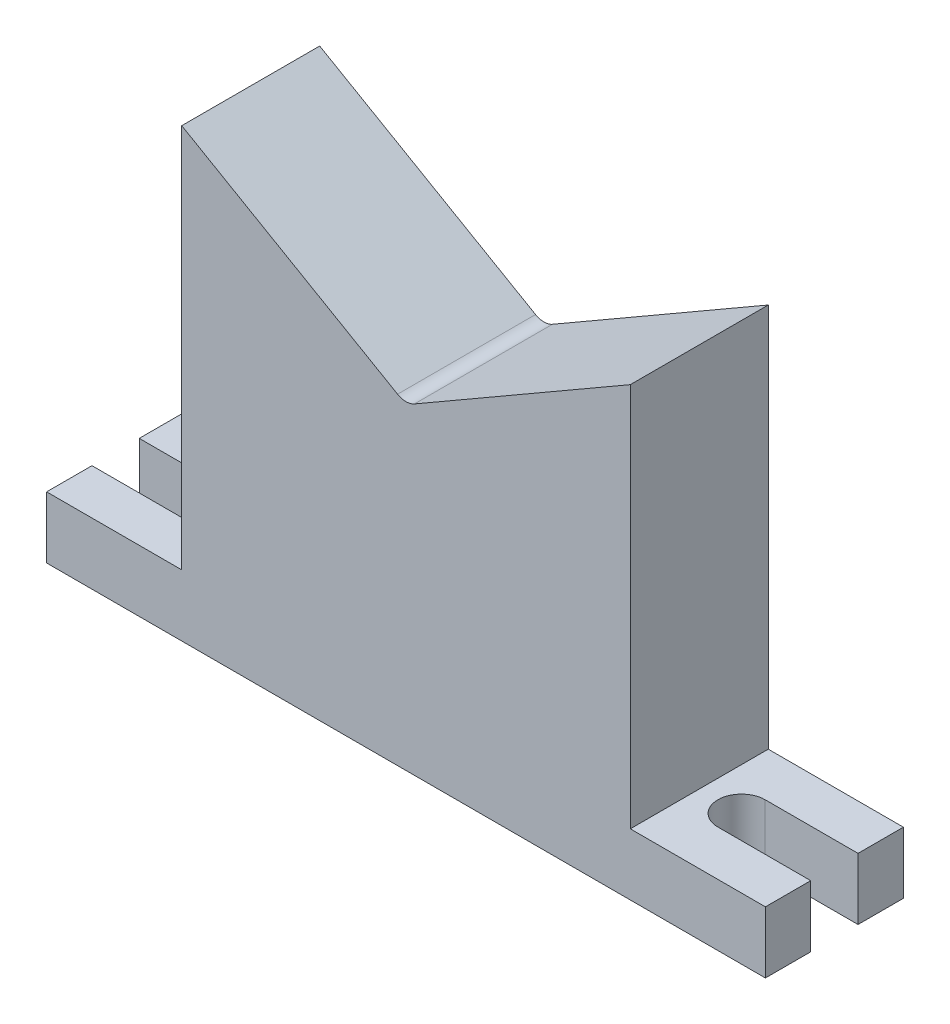
from build123d import *

# Parameters (mm, degrees)
BOSS_EXTRUDE1_DEPTH = 20.7518
CUT_EXTRUDE1_DEPTH  = 10
FILLET1_R           = 2.54


with BuildPart() as part:
    # Sketch1 → Boss-Extrude1 (new body)
    with BuildSketch(Plane.XY):
        Polygon((-33.735, 19.476911331), (0, 0), (33.735, 19.476911331), (33.735, -38.381474646), (54.055, -38.381474646), (54.055, -47.652474646), (-54.055, -47.652474646), (-54.055, -38.381474646), (-33.735, -38.381474646), align=None)
    extrude(amount=BOSS_EXTRUDE1_DEPTH)

    # Sketch2 → Cut-Extrude1 (cut)
    with BuildSketch(Plane(origin=(0, -38.381474646, 0), x_dir=(1, 0, 0), z_dir=(0, 1, 0))):
        with BuildLine():
            Line((-40.085, -6.8199), (-54.055, -6.8199))
            Line((-54.055, -6.8199), (-54.055, -13.9319))
            Line((-54.055, -13.9319), (-40.085, -13.9319))
            ThreePointArc((-40.085, -13.9319), (-36.529, -10.3759), (-40.085, -6.8199))
        make_face()
        with BuildLine():
            Line((54.055, -13.9319), (54.055, -6.8199))
            Line((54.055, -6.8199), (40.085, -6.8199))
            ThreePointArc((40.085, -6.8199), (36.529, -10.3759), (40.085, -13.9319))
            Line((40.085, -13.9319), (54.055, -13.9319))
        make_face()
    extrude(amount=-CUT_EXTRUDE1_DEPTH, mode=Mode.SUBTRACT)

    # Fillet1
    fillet1_edges = [part.edges().sort_by_distance(p)[0] for p in [
        (0, 0, 10.3759),
    ]]
    fillet(fillet1_edges, radius=FILLET1_R)


solid = part.part
